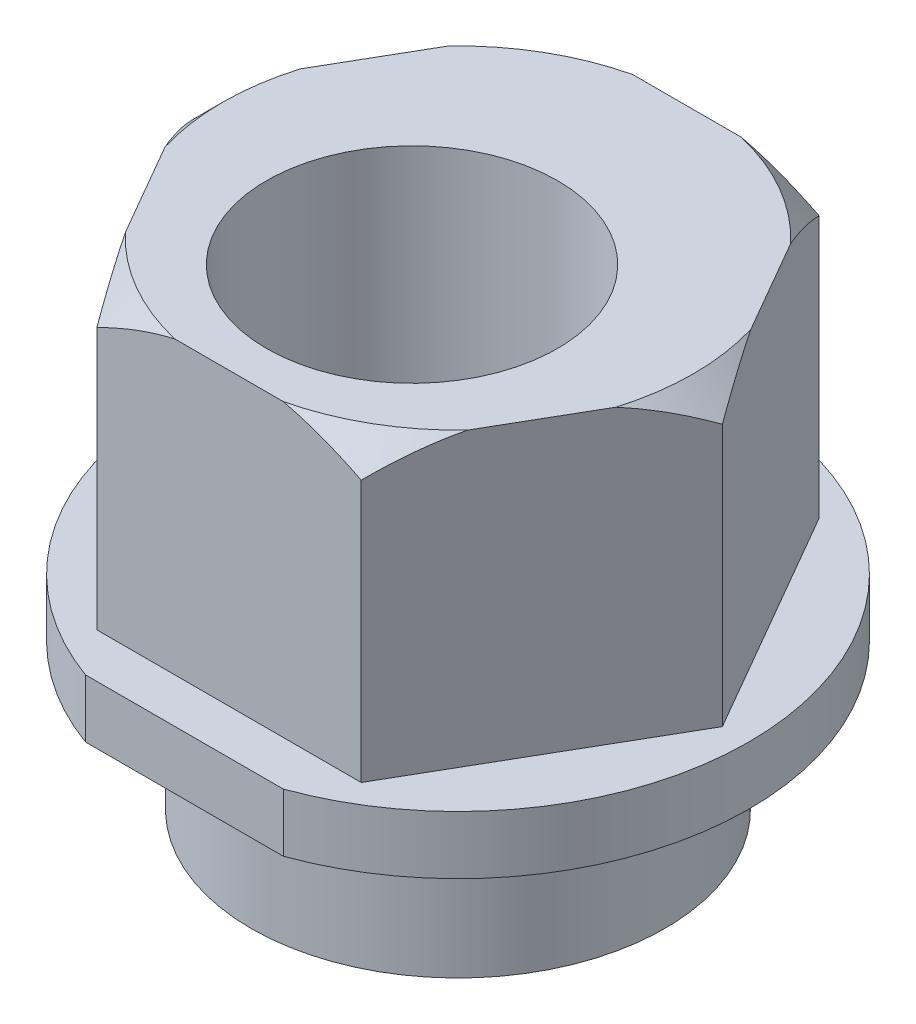
from build123d import *

# Parameters (mm, degrees)
BOSS_EXTRUDE1_DEPTH = 5
SKETCH2_R           = 5
BOSS_EXTRUDE2_DEPTH = 1
SKETCH3_R           = 3.555
BOSS_EXTRUDE3_DEPTH = 2.5
SKETCH4_R           = 2.5
CUT_EXTRUDE1_DEPTH  = 12.056672194
CUT_EXTRUDE2_DEPTH  = 9.660254038


with BuildPart() as part:
    # Sketch1 → Boss-Extrude1 (new body)
    with BuildSketch(Plane(origin=(0, 0, 0), x_dir=(1, 0, 0), z_dir=(0, 1, 0))):
        Polygon((4.543746619, 0), (2.271873309, 3.935), (-2.271873309, 3.935), (-4.543746619, 0), (-2.271873309, -3.935), (2.271873309, -3.935), align=None)
    extrude(amount=BOSS_EXTRUDE1_DEPTH)

    # Sketch2 → Boss-Extrude2 (add)
    with BuildSketch(Plane(origin=(0, 0, 0), x_dir=(1, 0, 0), z_dir=(0, 1, 0))):
        Circle(SKETCH2_R)
    extrude(amount=-BOSS_EXTRUDE2_DEPTH)

    # Sketch3 → Boss-Extrude3 (add)
    with BuildSketch(Plane.XZ.offset(1)):
        Circle(SKETCH3_R)
    extrude(amount=BOSS_EXTRUDE3_DEPTH)

    # Sketch4 → Cut-Extrude1 (cut, through all)
    with BuildSketch(Plane(origin=(0, 5, 0), x_dir=(1, 0, 0), z_dir=(0, 1, 0))):
        with Locations((0, -0.79)):
            Circle(SKETCH4_R)
    extrude(amount=-CUT_EXTRUDE1_DEPTH, mode=Mode.SUBTRACT)

    # Sketch5 → Cut-Extrude2 (cut, through all)
    with BuildSketch(Plane(origin=(0, 0, 0), x_dir=(1, 0, 0), z_dir=(0, 1, 0))):
        with BuildLine():
            Line((-1.7, -4.702127178), (1.7, -4.702127178))
            ThreePointArc((1.7, -4.702127178), (0, -5), (-1.7, -4.702127178))
        make_face()
    extrude(amount=-CUT_EXTRUDE2_DEPTH, mode=Mode.SUBTRACT)

    # Sketch6 → Cut-Revolve1 (revolve, cut)
    with BuildSketch(Plane.XY):
        Polygon((4.043746619, 5), (4.543746619, 5), (4.543746619, 4.5), align=None)
    revolve(axis=Axis((0, 0, 0), (0, 1, 0)), mode=Mode.SUBTRACT)


solid = part.part
